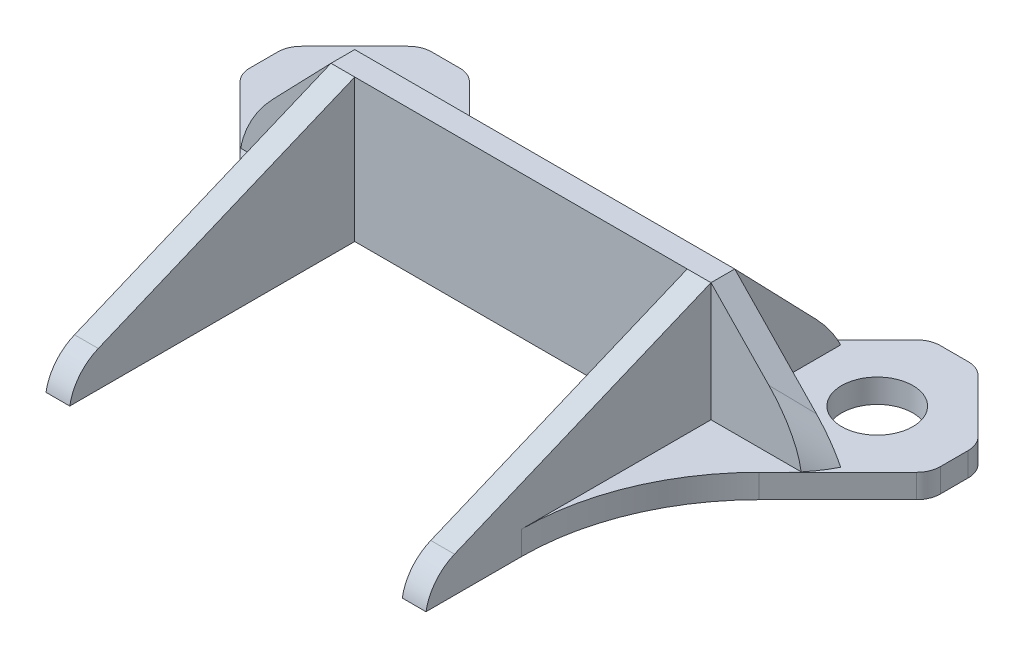
from build123d import *

# Parameters (mm, degrees)
BOSS_EXTRUDE5_DEPTH = 1
BOSS_EXTRUDE6_DEPTH = 5
BOSS_EXTRUDE7_DEPTH = 5
BOSS_EXTRUDE8_DEPTH = 5
CUT_EXTRUDE2_DEPTH  = 27.226956509
CUT_EXTRUDE3_DEPTH  = 27.226956509
CUT_EXTRUDE4_DEPTH  = 26.860820726
FILLET1_R           = 1
SKETCH2_10_R        = 1.5
CUT_EXTRUDE5_DEPTH  = 26.372860474
FILLET2_R           = 1
FILLET3_R           = 2


with BuildPart() as part:
    # Sketch2 → Boss-Extrude5 (new body)
    with BuildSketch(Plane(origin=(0, 0, 0), x_dir=(1, 0, 0), z_dir=(0, 1, 0))):
        with BuildLine():
            Line((-2.70717244, 7.535599565), (-1, 5.828427125))
            Line((-1, 5.828427125), (0, 4.828427125))
            Line((0, 4.828427125), (1.393918238, 3.434508886))
            ThreePointArc((1.393918238, 3.434508886), (7, 1.112393789), (12.606081762, 3.434508886))
            Line((12.606081762, 3.434508886), (14, 4.828427125))
            Line((14, 4.828427125), (15, 5.828427125))
            Line((15, 5.828427125), (16.70717244, 7.535599565))
            Line((16.70717244, 7.535599565), (18.70717244, 7.535599565))
            Line((18.70717244, 7.535599565), (20.121386002, 6.121386002))
            Line((20.121386002, 6.121386002), (21.535599565, 4.70717244))
            Line((21.535599565, 4.70717244), (21.535599565, 2.70717244))
            Line((21.535599565, 2.70717244), (19.828427125, 1))
            Line((19.828427125, 1), (18.828427125, 0))
            Line((18.828427125, 0), (17.928932188, -0.899494937))
            ThreePointArc((17.928932188, -0.899494937), (15.761204675, -4.143728425), (15, -7.970562748))
            Line((15, -7.970562748), (15, -12))
            Line((15, -12), (14, -12))
            Line((14, -12), (14, 0))
            Line((14, 0), (0, 0))
            Line((0, 0), (0, -12))
            Line((0, -12), (-1, -12))
            Line((-1, -12), (-1, -7.970562748))
            ThreePointArc((-1, -7.970562748), (-1.761204675, -4.143728425), (-3.928932188, -0.899494937))
            Line((-3.928932188, -0.899494937), (-4.828427125, 0))
            Line((-4.828427125, 0), (-5.828427125, 1))
            Line((-5.828427125, 1), (-7.535599565, 2.70717244))
            Line((-7.535599565, 2.70717244), (-7.535599565, 4.70717244))
            Line((-7.535599565, 4.70717244), (-6.121386002, 6.121386002))
            Line((-6.121386002, 6.121386002), (-4.70717244, 7.535599565))
            Line((-4.70717244, 7.535599565), (-2.70717244, 7.535599565))
        make_face()
    extrude(amount=BOSS_EXTRUDE5_DEPTH)

    # Sketch5 → Boss-Extrude6 (add)
    with BuildSketch(Plane(origin=(0, 1, 0), x_dir=(1, 0, 0), z_dir=(0, 1, 0))):
        Polygon((-4.828427125, 0), (18.828427125, 0), (19.828427125, 1), (-5.828427125, 1), align=None)
    extrude(amount=BOSS_EXTRUDE6_DEPTH)

    # Sketch5<3> → Boss-Extrude7 (add)
    with BuildSketch(Plane(origin=(0, 1, 0), x_dir=(1, 0, 0), z_dir=(0, 1, 0))):
        Polygon((-1, -12), (-1, 5.828427125), (0, 4.828427125), (0, -12), align=None)
    extrude(amount=BOSS_EXTRUDE7_DEPTH)

    # Sketch5<4> → Boss-Extrude8 (add)
    with BuildSketch(Plane(origin=(0, 1, 0), x_dir=(1, 0, 0), z_dir=(0, 1, 0))):
        Polygon((15, -12), (15, 5.828427125), (14, 4.828427125), (14, -12), align=None)
    extrude(amount=BOSS_EXTRUDE8_DEPTH)

    # Sketch6 → Cut-Extrude2 (cut, through all)
    with BuildSketch(Plane.ZY.offset(1)):
        Polygon((12, 1), (0, 6), (12, 6), align=None)
    extrude(amount=-CUT_EXTRUDE2_DEPTH, mode=Mode.SUBTRACT)

    # Sketch7 → Cut-Extrude3 (cut, through all)
    with BuildSketch(Plane.ZY.offset(1)):
        Polygon((-5.828427125, 1), (-1, 6), (-5.828427125, 6), align=None)
    extrude(amount=-CUT_EXTRUDE3_DEPTH, mode=Mode.SUBTRACT)

    # Sketch9 → Cut-Extrude4 (cut, through all)
    with BuildSketch(Plane(origin=(0, 0, -1), x_dir=(-1, 0, 0), z_dir=(0, 0, -1))):
        Polygon((5.828427125, 1), (1, 6), (5.828427125, 6), align=None)
        Polygon((-15, 6), (-19.828427125, 6), (-19.828427125, 1), align=None)
    extrude(amount=-CUT_EXTRUDE4_DEPTH, mode=Mode.SUBTRACT)

    # Fillet1
    fillet1_edges = [part.edges().sort_by_distance(p)[0] for p in [
        (21.535599565, 0.5, -2.70717244),
        (21.535599565, 0.5, -4.70717244),
        (18.70717244, 0.5, -7.535599565),
        (16.70717244, 0.5, -7.535599565),
    ]]
    fillet(fillet1_edges, radius=FILLET1_R)

    # Sketch2<10> → Cut-Extrude5 (cut, through all)
    with BuildSketch(Plane(origin=(0, 0, 0), x_dir=(1, 0, 0), z_dir=(0, 1, 0))):
        with Locations(Location((-4.000065659, 4.000065659, 0), (0, 0, 270))):
            Circle(SKETCH2_10_R)
        with Locations(Location((18.000065659, 4.000065659, 0), (0, 0, 90))):
            Circle(SKETCH2_10_R)
    extrude(amount=CUT_EXTRUDE5_DEPTH, mode=Mode.SUBTRACT)

    # Fillet2
    fillet2_edges = [part.edges().sort_by_distance(p)[0] for p in [
        (-4.70717244, 0.5, -7.535599565),
        (-7.535599565, 0.5, -4.70717244),
        (-7.535599565, 0.5, -2.70717244),
        (-2.70717244, 0.5, -7.535599565),
    ]]
    fillet(fillet2_edges, radius=FILLET2_R)

    # Fillet3
    # the kernel refuses this fillet: 2 mm, written as the material it takes off along each edge
    with BuildSketch(Plane(origin=(16.627933811, -0.685780658, -7.456360936), x_dir=(-0.41774894469873675, -0.8068281343670279, 0.4177489446987422), z_dir=(-0.5705136450630144, 0.5907862232600055, 0.5705136450630186))) as fillet3_piece_1_section:
        with BuildLine():
            CenterArc((FILLET3_R * 0.570690578744, FILLET3_R), FILLET3_R, 210.574008732, 59.425991268)
            Line((-FILLET3_R * 0.290282277773, FILLET3_R * 0.491349097769), (0, 0))
            Line((0, 0), (FILLET3_R * 0.570690578744, 0))
        make_face()
    fillet3_piece_1 = extrude(amount=7.459712243, mode=Mode.PRIVATE)
    fillet3_piece_1 = split(fillet3_piece_1, bisect_by=Plane(origin=(16.627933811, 1, -7.456360936), z_dir=(0, 1, 0)), keep=Keep.TOP, mode=Mode.PRIVATE)
    add(fillet3_piece_1, mode=Mode.SUBTRACT)
    with BuildSketch(Plane(origin=(1.627933811, 3.721314564, -3.200493313), x_dir=(0.41774894469873974, -0.8068281343670296, 0.41774894469873625), z_dir=(-0.5705136450630193, -0.5907862232600034, -0.5705136450630159))) as fillet3_piece_2_section:
        with BuildLine():
            CenterArc((FILLET3_R * 0.570690578744, FILLET3_R), FILLET3_R, 210.574008732, 59.425991268)
            Line((-FILLET3_R * 0.290282277773, FILLET3_R * 0.491349097769), (0, 0))
            Line((0, 0), (FILLET3_R * 0.570690578744, 0))
        make_face()
    fillet3_piece_2 = extrude(amount=7.459712243, mode=Mode.PRIVATE)
    fillet3_piece_2 = split(fillet3_piece_2, bisect_by=Plane(origin=(1.627933811, 1, -3.200493313), z_dir=(0, 1, 0)), keep=Keep.TOP, mode=Mode.PRIVATE)
    add(fillet3_piece_2, mode=Mode.SUBTRACT)
    with BuildSketch(Plane(origin=(-3.200493313, 3.721314564, 1.627933811), x_dir=(0.417748944698757, -0.8068281343670092, 0.4177489446987582), z_dir=(-0.570513645063002, -0.5907862232600312, -0.5705136450630045))) as fillet3_piece_3_section:
        with BuildLine():
            CenterArc((FILLET3_R * 0.570690578744, -FILLET3_R), FILLET3_R, 90, 59.425991268)
            Line((-FILLET3_R * 0.290282277773, -FILLET3_R * 0.491349097769), (0, 0))
            Line((0, 0), (FILLET3_R * 0.570690578744, 0))
        make_face()
    fillet3_piece_3 = extrude(amount=7.459712243, mode=Mode.PRIVATE)
    fillet3_piece_3 = split(fillet3_piece_3, bisect_by=Plane(origin=(-3.200493313, 1, 1.627933811), z_dir=(0, 1, 0)), keep=Keep.TOP, mode=Mode.PRIVATE)
    add(fillet3_piece_3, mode=Mode.SUBTRACT)
    with BuildSketch(Plane(origin=(17.200493313, 3.721314564, 1.627933811), x_dir=(-0.4177489446987597, -0.8068281343670061, 0.41774894469876167), z_dir=(0.5705136450629996, -0.5907862232600355, -0.5705136450630022))) as fillet3_piece_4_section:
        with BuildLine():
            CenterArc((FILLET3_R * 0.570690578744, FILLET3_R), FILLET3_R, 210.574008732, 59.425991268)
            Line((-FILLET3_R * 0.290282277773, FILLET3_R * 0.491349097769), (0, 0))
            Line((0, 0), (FILLET3_R * 0.570690578744, 0))
        make_face()
    fillet3_piece_4 = extrude(amount=7.459712243, mode=Mode.PRIVATE)
    fillet3_piece_4 = split(fillet3_piece_4, bisect_by=Plane(origin=(17.200493313, 1, 1.627933811), z_dir=(0, 1, 0)), keep=Keep.TOP, mode=Mode.PRIVATE)
    add(fillet3_piece_4, mode=Mode.SUBTRACT)
    with BuildSketch(Plane(origin=(10.748288019, 1, 12), x_dir=(0, -1, 0), z_dir=(1, 0, 0)), Plane(origin=(-4.251711981, 1, 12), x_dir=(0, -1, 0), z_dir=(1, 0, 0))) as fillet3_piece_5:
        with BuildLine():
            CenterArc((1.345890464, 1.969862885), FILLET3_R, 202.619864948, 57.421029607)
            Line((-0.500263382, 1.200632116), (0, 0))
            Line((0, 0), (1, 0))
        make_face()
    extrude(amount=7.503423962, mode=Mode.SUBTRACT)


solid = part.part
